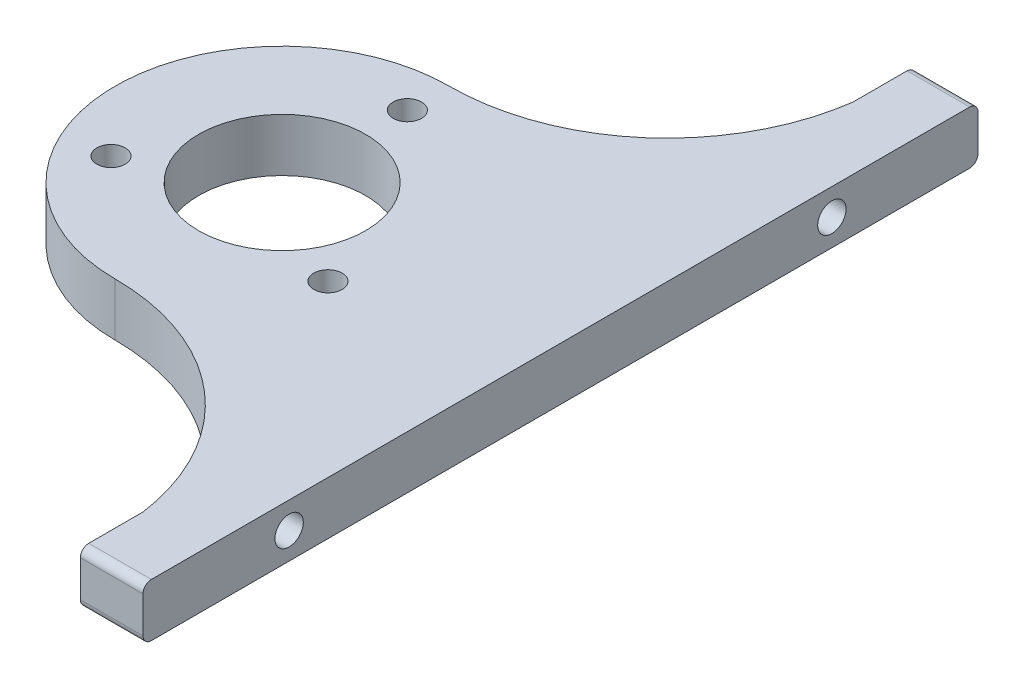
from build123d import *

# Parameters (mm, degrees)
SKETCH1_R                = 10
BOSS_EXTRUDE1_DEPTH      = 6.35
M3_CLEARANCE_HOLE1_D     = 3.4
M3_CLEARANCE_HOLE3_D     = 3.4
M3_CLEARANCE_HOLE3_DEPTH = 7
M3_CLEARANCE_HOLE3_TIP   = 1.021463052
FILLET1_R                = 1


with BuildPart() as part:
    # Sketch1 → Boss-Extrude1 (new body)
    with BuildSketch(Plane(origin=(0, 0, 0), x_dir=(1, 0, 0), z_dir=(0, 1, 0))):
        with BuildLine():
            Line((33.34, 50), (33.34, -50))
            Line((33.34, -50), (25.84, -50))
            Line((25.84, -50), (25.84, -42.5))
            ThreePointArc((25.84, -42.5), (17.131517738, -26.413305851), (0, -20))
            ThreePointArc((0, -20), (-20, 0), (0, 20))
            ThreePointArc((0, 20), (17.131517738, 26.413305851), (25.84, 42.5))
            Line((25.84, 42.5), (25.84, 50))
            Line((25.84, 50), (33.34, 50))
        make_face()
        Circle(SKETCH1_R, mode=Mode.SUBTRACT)
    extrude(amount=BOSS_EXTRUDE1_DEPTH)

    # M3 Clearance Hole1 (through all)
    with Locations(Plane(origin=(0, 6.35, 0), x_dir=(1, 0, 0), z_dir=(0, 1, 0))):
        with Locations((0, 15), (12.991881057, -7.499133975), (-12.988881057, -7.500866025), (0.001, 0)):
            Hole(M3_CLEARANCE_HOLE1_D / 2)

    # M3 Clearance Hole3
    with Locations(Plane(origin=(33.34, 0, 0), x_dir=(0, 0, -1), z_dir=(1, 0, 0))):
        with Locations((32.5, 3.175), (-32.5, 3.175)):
            Hole(M3_CLEARANCE_HOLE3_D / 2, depth=M3_CLEARANCE_HOLE3_DEPTH)
            with Locations((0, 0, -(M3_CLEARANCE_HOLE3_DEPTH + M3_CLEARANCE_HOLE3_TIP / 2))):  # 118° drill point
                Cone(0, M3_CLEARANCE_HOLE3_D / 2, M3_CLEARANCE_HOLE3_TIP, mode=Mode.SUBTRACT)

    # Fillet1
    fillet1_edges = [part.edges().sort_by_distance(p)[0] for p in [
        (29.59, 6.35, 50),
        (29.59, 0, 50),
        (29.59, 0, -50),
        (29.59, 6.35, -50),
    ]]
    fillet(fillet1_edges, radius=FILLET1_R)


solid = part.part
